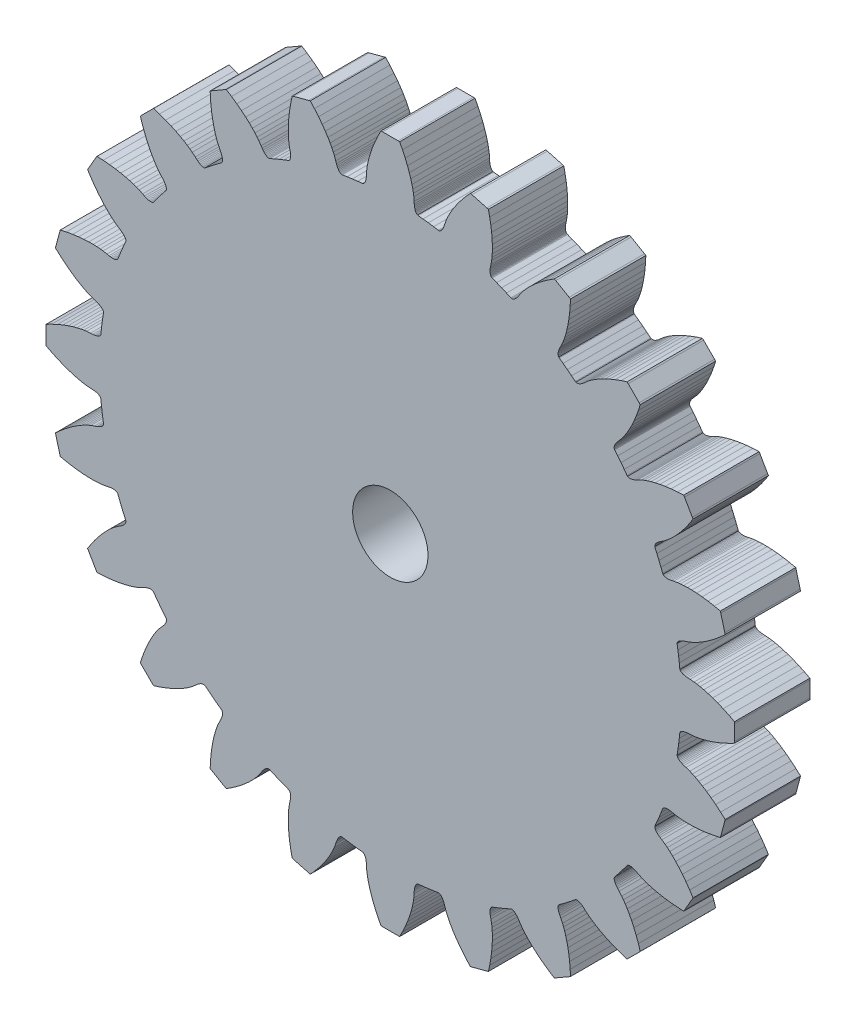
from build123d import *

# Parameters (mm, degrees)
SKETCH2_R           = 1.905
BOSS_EXTRUDE1_DEPTH = 3.81


with BuildPart() as part:
    # Sketch2 → Boss-Extrude1 (new body)
    with BuildSketch(Plane.XY):
        Polygon((3.289576242, 23.003571315), (3.038944057, 22.794199304), (2.802065264, 22.611666434), (2.578939862, 22.45437037), (2.372505468, 22.321776998), (2.181960915, 22.210281061), (2.010911459, 22.11908139), (1.861760607, 22.048044458), (1.731437212, 21.992229725), (1.541560299, 21.924130411), (1.439277799, 21.892217202), (1.369843203, 21.866179229), (1.308286764, 21.838672447), (1.25460848, 21.809696856), (1.20827424, 21.779920097), (1.169818157, 21.749475697), (1.138706117, 21.718363657), (1.115472233, 21.687919258), (1.100383561, 21.657474858), (1.092371877, 21.627030458), (1.093039517, 21.59164552), (1.130694433, 21.352630278), (1.168349348, 21.085173557), (1.201063725, 20.817983892), (1.226434058, 20.577366313), (1.235113382, 20.541981375), (1.250335582, 20.515142233), (1.273569466, 20.489638372), (1.304013865, 20.466538016), (1.341668781, 20.444772941), (1.386534212, 20.425277843), (1.439277799, 20.408586835), (1.498831317, 20.394165803), (1.565461823, 20.38401767), (1.638768733, 20.376673626), (1.745858244, 20.372400728), (1.947352099, 20.355843248), (2.087155986, 20.335413453), (2.249926702, 20.304969054), (2.439135974, 20.261572432), (2.651445603, 20.20295361), (2.885386779, 20.127510251), (3.14176067, 20.034040603), (3.417763187, 19.91880588), (3.713394331, 19.78127197), (3.991533297, 19.637862824), (3.993803274, 19.559615376), (3.993803274, 18.774203278), (3.991533297, 18.695421718), (3.713394331, 18.552546685), (3.417763187, 18.415012774), (3.14176067, 18.299778051), (2.885386779, 18.205640763), (2.651445603, 18.130998573), (2.439135974, 18.072246223), (2.249926702, 18.028849601), (2.087155986, 17.998405201), (1.947352099, 17.978108935), (1.745858244, 17.961551454), (1.638768733, 17.957145028), (1.565461823, 17.949800984), (1.498831317, 17.939118739), (1.439277799, 17.92523182), (1.386534212, 17.908540811), (1.341668781, 17.889045713), (1.304013865, 17.867280638), (1.273569466, 17.843379114), (1.250335582, 17.818008781), (1.235113382, 17.791303167), (1.226434058, 17.756452341), (1.201063725, 17.51596829), (1.168349348, 17.247843929), (1.130694433, 16.981321904), (1.093039517, 16.742306662), (1.092371877, 16.705987028), (1.100383561, 16.676343796), (1.115472233, 16.645899397), (1.138706117, 16.615454997), (1.169818157, 16.584342957), (1.20827424, 16.553898558), (1.25460848, 16.524255327), (1.308286764, 16.495279736), (1.369843203, 16.467639426), (1.439277799, 16.441601452), (1.541560299, 16.409688244), (1.731437212, 16.341588929), (1.861760607, 16.285907725), (2.010911459, 16.214203152), (2.181960915, 16.123537593), (2.372505468, 16.012041656), (2.578939862, 15.878780644), (2.802065264, 15.72148458), (3.038944057, 15.539619351), (3.289576242, 15.329579699), (3.520713328, 15.119540048), (3.501752342, 15.043429049), (3.299056735, 14.284188452), (3.276624019, 14.208878621), (2.971512383, 14.142915756), (2.649976794, 14.086433383), (2.353678011, 14.046642018), (2.081147223, 14.021939326), (1.836390274, 14.010455912), (1.615534849, 14.008987103), (1.422052678, 14.015529978), (1.256878457, 14.028482201), (1.116273401, 14.04517321), (0.917850692, 14.081359316), (0.812630574, 14.1045932), (0.740391889, 14.116877782), (0.673093742, 14.123420658), (0.612071415, 14.125557107), (0.557191379, 14.122619489), (0.508587162, 14.116210142), (0.466392293, 14.1045932), (0.431007355, 14.089371), (0.402031764, 14.071211183), (0.38013316, 14.048778467), (0.36290804, 14.017666428), (0.275981267, 13.791603408), (0.175301104, 13.541638864), (0.070348042, 13.293944297), (-0.028329201, 13.072287704), (-0.038343806, 13.038238046), (-0.038343806, 13.006992478), (-0.03113329, 12.973743989), (-0.016712259, 12.937557883), (0.005052816, 12.899902967), (0.033894879, 12.860779243), (0.070882154, 12.820186711), (0.115881113, 12.778125369), (0.168090588, 12.735396387), (0.228178219, 12.692654052), (0.318576721, 12.635423922), (0.48455211, 12.520242611), (0.595513935, 12.432568081), (0.721430903, 12.325358395), (0.863504768, 12.192791729), (1.018530855, 12.035589134), (1.183571548, 11.85375061), (1.358226261, 11.644391952), (1.54009149, 11.406778754), (1.727030786, 11.139468914), (1.896477905, 10.876485384), (1.858822989, 10.807665017), (1.466250468, 10.128140677), (1.425657936, 10.060775767), (1.112801671, 10.075263562), (0.788194937, 10.104239153), (0.491094985, 10.142641826), (0.222436512, 10.189723823), (-0.017379899, 10.241158834), (-0.231024808, 10.296946861), (-0.416495295, 10.354176992), (-0.572990191, 10.409230614), (-0.704114755, 10.461386678), (-0.886781152, 10.547605751), (-0.981586081, 10.597585307), (-1.049151283, 10.628016354), (-1.111909475, 10.651917878), (-1.170795353, 10.669303233), (-1.224340109, 10.680893469), (-1.272944326, 10.686688587), (-1.316340948, 10.686688587), (-1.354797032, 10.681614521), (-1.38737788, 10.671466388), (-1.414083494, 10.655536489), (-1.438786187, 10.629458457), (-1.580860051, 10.433866543), (-1.743096654, 10.218699413), (-1.908938515, 10.006443196), (-2.061828153, 9.818088503), (-2.079854443, 9.787657456), (-2.088533767, 9.757226409), (-2.090002576, 9.723190105), (-2.08559615, 9.684787432), (-2.074112736, 9.642779502), (-2.055952918, 9.597139608), (-2.030716114, 9.548588802), (-1.998802905, 9.496446092), (-1.959011541, 9.442100168), (-1.911876133, 9.384870038), (-1.839370392, 9.305914891), (-1.708913469, 9.151609855), (-1.624256673, 9.038591698), (-1.530787026, 8.90168537), (-1.427970413, 8.737218848), (-1.318610925, 8.545979948), (-1.206180291, 8.327194208), (-1.091746737, 8.07944623), (-0.977313182, 7.80343036), (-0.865683717, 7.496983443), (-0.770878789, 7.198534858), (-0.825224713, 7.142025779), (-1.380167365, 6.587109833), (-1.436516209, 6.532763909), (-1.73508497, 6.627662307), (-2.041531887, 6.739238361), (-2.317400876, 6.853698621), (-2.565228971, 6.968158882), (-2.784081475, 7.080455987), (-2.975293669, 7.189828828), (-3.139800249, 7.292712204), (-3.276666519, 7.386155147), (-3.389764793, 7.470905412), (-3.543989712, 7.601308923), (-3.623038329, 7.673761253), (-3.680188342, 7.720856603), (-3.734534266, 7.760688026), (-3.786610212, 7.792561176), (-3.835214429, 7.817918156), (-3.880881029, 7.836037915), (-3.92294237, 7.847628151), (-3.961264926, 7.851967813), (-3.995314583, 7.85052571), (-4.025625455, 7.84181968), (-4.056069854, 7.823726627), (-4.244477959, 7.670850341), (-4.456921115, 7.504955069), (-4.672034834, 7.34269176), (-4.867386398, 7.200698013), (-4.893557899, 7.176075437), (-4.909581267, 7.149263001), (-4.9197294, 7.116668799), (-4.924803467, 7.078266127), (-4.924803467, 7.034816093), (-4.91906176, 6.986265288), (-4.90731129, 6.932667121), (-4.890086169, 6.873981535), (-4.866184645, 6.810942934), (-4.835740245, 6.743578023), (-4.78566722, 6.648679625), (-4.699408088, 6.466133403), (-4.647332141, 6.334995487), (-4.592185049, 6.178527297), (-4.534901507, 5.993070162), (-4.479353831, 5.779345136), (-4.427678468, 5.539582137), (-4.380676588, 5.270790135), (-4.342220505, 4.973783653), (-4.313378442, 4.649243683), (-4.298823883, 4.336280596), (-4.366122029, 4.295701416), (-5.045646369, 3.903062131), (-5.114413324, 3.865393863), (-5.377463619, 4.034921099), (-5.64492034, 4.221820336), (-5.882466773, 4.403658859), (-6.091838784, 4.578246809), (-6.273570485, 4.743421029), (-6.43086655, 4.898433764), (-6.563459922, 5.040440864), (-6.670682961, 5.166478008), (-6.758410901, 5.277319658), (-6.873512096, 5.44321493), (-6.93066211, 5.533773666), (-6.97352462, 5.593901355), (-7.016120073, 5.646070771), (-7.058181415, 5.690976261), (-7.098907476, 5.727923477), (-7.1380312, 5.756899068), (-7.175686115, 5.778624085), (-7.211738694, 5.79311188), (-7.245120711, 5.800362454), (-7.276366279, 5.800362454), (-7.310282408, 5.790214321), (-7.532072529, 5.691710665), (-7.779900624, 5.586664134), (-8.029598112, 5.485957264), (-8.255661132, 5.399017139), (-8.2869067, 5.381645137), (-8.309339415, 5.359906768), (-8.327499233, 5.33094453), (-8.342721432, 5.295439417), (-8.354204846, 5.253418133), (-8.360747722, 5.204880681), (-8.363685339, 5.149827058), (-8.361415362, 5.088978317), (-8.355006015, 5.021600054), (-8.342721432, 4.949161077), (-8.319487549, 4.844114546), (-8.283167914, 4.645611719), (-8.266610433, 4.505073427), (-8.253524683, 4.339899207), (-8.246981807, 4.146470447), (-8.248450616, 3.925521552), (-8.25993403, 3.68065778), (-8.284636723, 3.408287227), (-8.324561615, 3.11197509), (-8.381043988, 2.790319326), (-8.446873326, 2.485341218), (-8.522183156, 2.462881797), (-9.281423753, 2.260052661), (-9.357534752, 2.241211851), (-9.567574403, 2.472308879), (-9.777747583, 2.722967769), (-9.959479284, 2.959846562), (-10.116775348, 3.182971964), (-10.250169889, 3.389446416), (-10.361532298, 3.579977617), (-10.452331384, 3.750933603), (-10.523902429, 3.900164572), (-10.579717161, 4.030554731), (-10.647682948, 4.220378233), (-10.679596157, 4.322527205), (-10.705767658, 4.392068623), (-10.73327444, 4.453638415), (-10.762383559, 4.507249935), (-10.79202679, 4.553624233), (-10.82247119, 4.592013552), (-10.85358323, 4.623165651), (-10.884027629, 4.646346123), (-10.914472029, 4.66155497), (-10.94411526, 4.669526596), (-10.980301367, 4.668792192), (-11.219316609, 4.631123924), (-11.485972161, 4.593455656), (-11.753962995, 4.560848101), (-11.994580574, 4.535504474), (-12.0294314, 4.526798444), (-12.056137013, 4.511589597), (-12.081507346, 4.488409124), (-12.10540887, 4.457978077), (-12.127173946, 4.420309809), (-12.146535515, 4.375390967), (-12.163226524, 4.322527205), (-12.177246971, 4.263107215), (-12.187929217, 4.196463356), (-12.195139732, 4.123289974), (-12.199679687, 4.016080288), (-12.216103639, 3.814693255), (-12.236533434, 3.674876015), (-12.266977833, 3.511878302), (-12.310374455, 3.322789204), (-12.369126805, 3.110532987), (-12.443635468, 2.8765384), (-12.537906284, 2.620097745), (-12.653007479, 2.344081875), (-12.790674917, 2.048504143), (-12.933416422, 1.770325118), (-13.012331511, 1.76814861), (-13.797743609, 1.76814861), (-13.875991057, 1.770325118), (-14.019266674, 2.048504143), (-14.156934113, 2.344081875), (-14.272035307, 2.620097745), (-14.365504955, 2.8765384), (-14.441081842, 3.110532987), (-14.499700664, 3.322789204), (-14.543097286, 3.511878302), (-14.573541686, 3.674876015), (-14.593837952, 3.814693255), (-14.610528961, 4.016080288), (-14.614801859, 4.123289974), (-14.622012375, 4.196463356), (-14.632160508, 4.263107215), (-14.646715067, 4.322527205), (-14.663406076, 4.375390967), (-14.682901174, 4.420309809), (-14.704666249, 4.457978077), (-14.727766605, 4.488409124), (-14.753270466, 4.511589597), (-14.779976079, 4.526798444), (-14.815494546, 4.535504474), (-15.055978597, 4.560848101), (-15.32330179, 4.593455656), (-15.590624982, 4.631123924), (-15.829640225, 4.668792192), (-15.865158691, 4.669526596), (-15.89560309, 4.66155497), (-15.92604749, 4.646346123), (-15.95649189, 4.623165651), (-15.98760393, 4.592013552), (-16.018048329, 4.553624233), (-16.047825088, 4.507249935), (-16.076800679, 4.453638415), (-16.104307461, 4.392068623), (-16.130345435, 4.322527205), (-16.162258643, 4.220378233), (-16.230357958, 4.030554731), (-16.286039162, 3.900164572), (-16.357076095, 3.750933603), (-16.448409293, 3.579977617), (-16.55990523, 3.389446416), (-16.692498602, 3.182971964), (-16.849661139, 2.959846562), (-17.032327536, 2.722967769), (-17.241566019, 2.472308879), (-17.452406839, 2.241211851), (-17.529185479, 2.260052661), (-18.287758435, 2.462881797), (-18.362400625, 2.485341218), (-18.429031131, 2.790319326), (-18.485513504, 3.11197509), (-18.524637228, 3.408287227), (-18.549206393, 3.68065778), (-18.561490975, 3.925521552), (-18.562959784, 4.146470447), (-18.555749268, 4.339899207), (-18.543464686, 4.505073427), (-18.526106037, 4.645611719), (-18.490587571, 4.844114546), (-18.466686047, 4.949161077), (-18.455069105, 5.021600054), (-18.447858589, 5.088978317), (-18.44638978, 5.149827058), (-18.448526229, 5.204880681), (-18.455736745, 5.253418133), (-18.467353687, 5.295439417), (-18.481908246, 5.33094453), (-18.500735704, 5.359906768), (-18.522500779, 5.381645137), (-18.554280459, 5.399017139), (-18.780343479, 5.485957264), (-19.030308023, 5.586664134), (-19.27800259, 5.691710665), (-19.498991543, 5.790214321), (-19.533708841, 5.800362454), (-19.564954409, 5.800362454), (-19.598202898, 5.79311188), (-19.633721364, 5.778624085), (-19.671376279, 5.756899068), (-19.711167644, 5.727923477), (-19.751813588, 5.690976261), (-19.793808165, 5.646070771), (-19.835842801, 5.593901355), (-19.879306187, 5.533773666), (-19.936536317, 5.44321493), (-20.051730982, 5.277319658), (-20.138644402, 5.166478008), (-20.246588492, 5.040440864), (-20.379168511, 4.898433764), (-20.535636702, 4.743421029), (-20.717475225, 4.578246809), (-20.927554935, 4.403658859), (-21.164460434, 4.221820336), (-21.431783627, 4.034921099), (-21.695461503, 3.865393863), (-21.765002921, 3.903062131), (-22.444527261, 4.295701416), (-22.511184473, 4.336280596), (-22.495975626, 4.649243683), (-22.467707734, 4.973783653), (-22.428597362, 5.270790135), (-22.382236417, 5.539582137), (-22.330067001, 5.779345136), (-22.274278974, 5.993070162), (-22.217796601, 6.178527297), (-22.162729626, 6.334995487), (-22.110560209, 6.466133403), (-22.024367841, 6.648679625), (-21.974388285, 6.743578023), (-21.943943886, 6.810942934), (-21.920042361, 6.873981535), (-21.901922602, 6.932667121), (-21.890332366, 6.986265288), (-21.884550601, 7.034816093), (-21.884550601, 7.078266127), (-21.890332366, 7.116668799), (-21.900480499, 7.149263001), (-21.916423751, 7.176075437), (-21.941780731, 7.200698013), (-22.13810705, 7.34269176), (-22.353247473, 7.504955069), (-22.565517044, 7.670850341), (-22.753871737, 7.823726627), (-22.784289431, 7.84181968), (-22.813999426, 7.85052571), (-22.848770135, 7.851967813), (-22.886438403, 7.847628151), (-22.928459686, 7.836037915), (-22.97409958, 7.817918156), (-23.023358084, 7.792561176), (-23.075527501, 7.760688026), (-23.129846719, 7.720856603), (-23.187076849, 7.673761253), (-23.266045349, 7.601308923), (-23.41961598, 7.470905412), (-23.533355189, 7.386155147), (-23.669553818, 7.292712204), (-23.834006987, 7.189828828), (-24.025980291, 7.080455987), (-24.244031627, 6.968158882), (-24.491792958, 6.853698621), (-24.768529879, 6.739238361), (-25.074963443, 6.627662307), (-25.37270433, 6.532763909), (-25.42993446, 6.587109833), (-25.985584811, 7.142025779), (-26.039182978, 7.198534858), (-25.94428458, 7.496983443), (-25.831987474, 7.80343036), (-25.718274971, 8.07944623), (-25.603080307, 8.327194208), (-25.490783201, 8.545979948), (-25.382131412, 8.737218848), (-25.279261388, 8.90168537), (-25.185805093, 9.038591698), (-25.101041475, 9.151609855), (-24.970637964, 9.305914891), (-24.897477935, 9.384870038), (-24.85111699, 9.442100168), (-24.811258861, 9.496446092), (-24.779399064, 9.548588802), (-24.754028731, 9.597139608), (-24.735922325, 9.642779502), (-24.724332089, 9.684787432), (-24.719979074, 9.723190105), (-24.721447882, 9.757226409), (-24.729406155, 9.787657456), (-24.748246966, 9.818088503), (-24.900375494, 10.006443196), (-25.066257413, 10.218699413), (-25.228534075, 10.433866543), (-25.371262227, 10.629458457), (-25.395898156, 10.655536489), (-25.422683886, 10.671466388), (-25.455291441, 10.681614521), (-25.492959709, 10.686688587), (-25.537157499, 10.686688587), (-25.585681599, 10.680893469), (-25.639306471, 10.669303233), (-25.697978705, 10.651917878), (-25.761003953, 10.628016354), (-25.828368863, 10.597585307), (-25.923267262, 10.547605751), (-26.105840189, 10.461386678), (-26.2369514, 10.409230614), (-26.393432943, 10.354176992), (-26.578890077, 10.296946861), (-26.791867346, 10.241158834), (-27.032391456, 10.189723823), (-27.301156752, 10.142641826), (-27.597455535, 10.104239153), (-27.92272991, 10.075263562), (-28.234958592, 10.060775767), (-28.276245471, 10.128140677), (-28.669605807, 10.807665017), (-28.706553024, 10.876485384), (-28.537052494, 11.139468914), (-28.350139904, 11.406778754), (-28.16830138, 11.644391952), (-27.992992379, 11.85375061), (-27.827831512, 12.035589134), (-27.673513123, 12.192791729), (-27.531519375, 12.325358395), (-27.405468879, 12.432568081), (-27.294640582, 12.520242611), (-27.128731957, 12.635423922), (-27.038173221, 12.692654052), (-26.978045532, 12.735396387), (-26.925902821, 12.778125369), (-26.880983979, 12.820186711), (-26.844036763, 12.860779243), (-26.814326767, 12.899902967), (-26.792588398, 12.937557883), (-26.778113955, 12.973743989), (-26.770863381, 13.006992478), (-26.771584433, 13.038238046), (-26.780998161, 13.072287704), (-26.880262927, 13.293944297), (-26.985296106, 13.541638864), (-27.086002975, 13.791603408), (-27.172929748, 14.017666428), (-27.190328455, 14.048778467), (-27.212040119, 14.071211183), (-27.240308011, 14.089371), (-27.275799772, 14.1045932), (-27.318542106, 14.116210142), (-27.367079559, 14.122619489), (-27.422146534, 14.125557107), (-27.482995275, 14.123420658), (-27.549639134, 14.116877782), (-27.622812516, 14.1045932), (-27.727124643, 14.081359316), (-27.926335168, 14.04517321), (-28.066152408, 14.028482201), (-28.23204768, 14.015529978), (-28.42547644, 14.008987103), (-28.645704283, 14.010455912), (-28.891289106, 14.021939326), (-29.162965314, 14.046642018), (-29.459971797, 14.086433383), (-29.780893156, 14.142915756), (-30.086605669, 14.208878621), (-30.10906509, 14.284188452), (-30.312641983, 15.043429049), (-30.330735036, 15.119540048), (-30.098916957, 15.329579699), (-29.848992471, 15.539619351), (-29.612100325, 15.72148458), (-29.388974923, 15.878780644), (-29.182500471, 16.012041656), (-28.991982623, 16.123537593), (-28.821013284, 16.214203152), (-28.671061263, 16.285907725), (-28.541392156, 16.341588929), (-28.35159536, 16.409688244), (-28.248725336, 16.441601452), (-28.179891617, 16.467639426), (-28.118321824, 16.495279736), (-28.064710305, 16.524255327), (-28.01834936, 16.553898558), (-27.97996004, 16.584342957), (-27.948794589, 16.615454997), (-27.925614116, 16.645899397), (-27.909684218, 16.676343796), (-27.902433644, 16.705987028), (-27.903154695, 16.742306662), (-27.940822963, 16.981321904), (-27.978504584, 17.247843929), (-28.011098786, 17.51596829), (-28.036469119, 17.756452341), (-28.045148443, 17.791303167), (-28.060370643, 17.818008781), (-28.083551115, 17.843379114), (-28.113968809, 17.867280638), (-28.151637077, 17.889045713), (-28.19655592, 17.908540811), (-28.248725336, 17.92523182), (-28.308118621, 17.939118739), (-28.374775832, 17.949800984), (-28.448656913, 17.957145028), (-28.555866599, 17.961551454), (-28.756545933, 17.978108935), (-28.897084225, 17.998405201), (-29.059360886, 18.028849601), (-29.248436631, 18.072246223), (-29.4614139, 18.130998573), (-29.69542184, 18.205640763), (-29.951141443, 18.299778051), (-30.227878365, 18.415012774), (-30.523442744, 18.552546685), (-30.801621769, 18.695421718), (-30.803798277, 18.774203278), (-30.803798277, 19.559615376), (-30.801621769, 19.637862824), (-30.523442744, 19.78127197), (-30.227878365, 19.91880588), (-29.951141443, 20.034040603), (-29.69542184, 20.127510251), (-29.4614139, 20.20295361), (-29.248436631, 20.261572432), (-29.059360886, 20.304969054), (-28.897084225, 20.335413453), (-28.756545933, 20.355843248), (-28.555866599, 20.372400728), (-28.448656913, 20.376673626), (-28.374775832, 20.38401767), (-28.308118621, 20.394165803), (-28.248725336, 20.408586835), (-28.19655592, 20.425277843), (-28.151637077, 20.444772941), (-28.113968809, 20.466538016), (-28.083551115, 20.489638372), (-28.060370643, 20.515142233), (-28.045148443, 20.541981375), (-28.036469119, 20.577366313), (-28.011098786, 20.817983892), (-27.978504584, 21.085173557), (-27.940822963, 21.352630278), (-27.903154695, 21.59164552), (-27.902433644, 21.627030458), (-27.909684218, 21.657474858), (-27.925614116, 21.687919258), (-27.948794589, 21.718363657), (-27.97996004, 21.749475697), (-28.01834936, 21.779920097), (-28.064710305, 21.809696856), (-28.118321824, 21.838672447), (-28.179891617, 21.866179229), (-28.248725336, 21.892217202), (-28.35159536, 21.924130411), (-28.541392156, 21.992229725), (-28.671061263, 22.048044458), (-28.821013284, 22.11908139), (-28.991982623, 22.210281061), (-29.182500471, 22.321776998), (-29.388974923, 22.45437037), (-29.612100325, 22.611666434), (-29.848992471, 22.794199304), (-30.098916957, 23.003571315), (-30.330735036, 23.214412135), (-30.312641983, 23.291190774), (-30.10906509, 24.049630202), (-30.086605669, 24.124272393), (-29.780893156, 24.190769371), (-29.459971797, 24.247385272), (-29.162965314, 24.286508996), (-28.891289106, 24.311211688), (-28.645704283, 24.323362743), (-28.42547644, 24.324965079), (-28.23204768, 24.317621036), (-28.066152408, 24.305469981), (-27.926335168, 24.287977805), (-27.727124643, 24.252592866), (-27.622812516, 24.228691342), (-27.549639134, 24.216940872), (-27.482995275, 24.209730356), (-27.422146534, 24.208261548), (-27.367079559, 24.210531525), (-27.318542106, 24.217742041), (-27.275799772, 24.229358982), (-27.240308011, 24.243913542), (-27.212040119, 24.262607472), (-27.190328455, 24.284239019), (-27.172929748, 24.316152227), (-27.086002975, 24.542215247), (-26.985296106, 24.792313319), (-26.880262927, 25.040007885), (-26.780998161, 25.26086331), (-26.771584433, 25.295714136), (-26.770863381, 25.326692648), (-26.778113955, 25.360074665), (-26.792588398, 25.39572666), (-26.814326767, 25.433381575), (-26.844036763, 25.473306467), (-26.880983979, 25.513631944), (-26.925902821, 25.555826813), (-26.978045532, 25.597621099), (-27.038173221, 25.641284777), (-27.128731957, 25.69843479), (-27.294640582, 25.813535985), (-27.405468879, 25.900596286), (-27.531519375, 26.008486965), (-27.673513123, 26.141080337), (-27.827831512, 26.297575233), (-27.992992379, 26.479306934), (-28.16830138, 26.689480114), (-28.350139904, 26.926225379), (-28.537052494, 27.1936821), (-28.706553024, 27.457400035), (-28.669605807, 27.526968158), (-28.276245471, 28.206492498), (-28.234958592, 28.273123004), (-27.92272991, 28.257900805), (-27.597455535, 28.229726382), (-27.301156752, 28.19046913), (-27.032391456, 28.14413489), (-26.791867346, 28.092058944), (-26.578890077, 28.036244211), (-26.393432943, 27.97962831), (-26.2369514, 27.924614746), (-26.105840189, 27.872538799), (-25.923267262, 27.786279667), (-25.828368863, 27.73634017), (-25.761003953, 27.70589577), (-25.697978705, 27.681994246), (-25.639306471, 27.663834428), (-25.585681599, 27.652351015), (-25.537157499, 27.64647578), (-25.492959709, 27.64647578), (-25.455291441, 27.652351015), (-25.422683886, 27.66236562), (-25.395898156, 27.67825546), (-25.371262227, 27.703759321), (-25.228534075, 27.899912053), (-25.066257413, 28.115292828), (-24.900375494, 28.327468928), (-24.748246966, 28.515877033), (-24.729406155, 28.546187904), (-24.721447882, 28.575964663), (-24.719979074, 28.610815489), (-24.724332089, 28.648470404), (-24.735922325, 28.690398218), (-24.754028731, 28.735931289), (-24.779399064, 28.785336675), (-24.811258861, 28.837412621), (-24.85111699, 28.891758545), (-24.897477935, 28.949042086), (-24.970637964, 29.028090703), (-25.101041475, 29.181647981), (-25.185805093, 29.295280368), (-25.279261388, 29.431478997), (-25.382131412, 29.595985577), (-25.490783201, 29.787865412), (-25.603080307, 30.005916747), (-25.718274971, 30.253744842), (-25.831987474, 30.530415), (-25.94428458, 30.836861917), (-26.039182978, 31.134629509), (-25.985584811, 31.191779522), (-25.42993446, 31.747523343), (-25.37270433, 31.801201626), (-25.074963443, 31.70626317), (-24.768529879, 31.593832536), (-24.491792958, 31.48020015), (-24.244031627, 31.364965427), (-24.025980291, 31.25280185), (-23.834006987, 31.144110002), (-23.669553818, 31.041159861), (-23.533355189, 30.947690213), (-23.41961598, 30.86289989), (-23.266045349, 30.732576495), (-23.187076849, 30.659269586), (-23.129846719, 30.612935346), (-23.075527501, 30.57327751), (-23.023358084, 30.541364301), (-22.97409958, 30.515993968), (-22.928459686, 30.497834151), (-22.886438403, 30.486350737), (-22.848770135, 30.481810783), (-22.813999426, 30.483279592), (-22.784289431, 30.491291276), (-22.753871737, 30.510252261), (-22.565517044, 30.662340731), (-22.353247473, 30.82831612), (-22.13810705, 30.990552723), (-21.941780731, 31.1331607), (-21.916423751, 31.157863393), (-21.900480499, 31.184569007), (-21.890332366, 31.217149855), (-21.884550601, 31.254804771), (-21.884550601, 31.299136089), (-21.890332366, 31.347606778), (-21.901922602, 31.401151533), (-21.920042361, 31.459903884), (-21.943943886, 31.522929132), (-21.974388285, 31.590360806), (-22.024367841, 31.685299263), (-22.110560209, 31.867698604), (-22.162729626, 31.998823167), (-22.217796601, 32.155451592), (-22.274278974, 32.34078855), (-22.330067001, 32.553765819), (-22.382236417, 32.794249871), (-22.428597362, 33.063041872), (-22.467707734, 33.359340656), (-22.495975626, 33.68461503), (-22.511184473, 33.996803654), (-22.444527261, 34.038197355), (-21.765002921, 34.431437517), (-21.695461503, 34.468424791), (-21.431783627, 34.298844145), (-21.164460434, 34.112171905), (-20.927554935, 33.930173148), (-20.717475225, 33.754984322), (-20.535636702, 33.589676574), (-20.379168511, 33.435451655), (-20.246588492, 33.293511318), (-20.138644402, 33.167460822), (-20.051730982, 33.056498997), (-19.936536317, 32.890790664), (-19.879306187, 32.799991577), (-19.835842801, 32.739903947), (-19.793808165, 32.687828), (-19.751813588, 32.642962569), (-19.711167644, 32.605841766), (-19.671376279, 32.576198535), (-19.633721364, 32.55443346), (-19.598202898, 32.540012428), (-19.564954409, 32.532801913), (-19.533708841, 32.533469553), (-19.498991543, 32.542950046), (-19.27800259, 32.642161401), (-19.030308023, 32.74724799), (-18.780343479, 32.847928154), (-18.554280459, 32.934854927), (-18.522500779, 32.952347103), (-18.500735704, 32.973978651), (-18.481908246, 33.002153073), (-18.467353687, 33.037805067), (-18.455736745, 33.080400521), (-18.448526229, 33.129004738), (-18.44638978, 33.18415183), (-18.447858589, 33.244907101), (-18.455069105, 33.311537607), (-18.466686047, 33.384710989), (-18.490587571, 33.48899641), (-18.526106037, 33.688220288), (-18.543464686, 33.828024176), (-18.555749268, 33.993999565), (-18.562959784, 34.187481736), (-18.561490975, 34.407535992), (-18.549206393, 34.653361166), (-18.524637228, 34.924823729), (-18.485513504, 35.221923681), (-18.429031131, 35.542791629), (-18.362400625, 35.848570906), (-18.287758435, 35.871003621), (-17.529185479, 36.074633926), (-17.452406839, 36.092660215), (-17.241566019, 35.860855488), (-17.032327536, 35.611024472), (-16.849661139, 35.374012151), (-16.692498602, 35.150886749), (-16.55990523, 34.944452355), (-16.448409293, 34.75404133), (-16.357076095, 34.582991874), (-16.286039162, 34.433039853), (-16.230357958, 34.303384099), (-16.162258643, 34.113373658), (-16.130345435, 34.010690573), (-16.104307461, 33.941923618), (-16.076800679, 33.880367178), (-16.047825088, 33.826688895), (-16.018048329, 33.780354655), (-15.98760393, 33.741765044), (-15.95649189, 33.710786532), (-15.92604749, 33.687686176), (-15.89560309, 33.671662808), (-15.865158691, 33.664452292), (-15.829640225, 33.664986404), (-15.590624982, 33.702774848), (-15.32330179, 33.740429763), (-15.055978597, 33.772877083), (-14.815494546, 33.798380945), (-14.779976079, 33.807060269), (-14.753270466, 33.822282469), (-14.727766605, 33.845516353), (-14.704666249, 33.875827224), (-14.682901174, 33.913482139), (-14.663406076, 33.95834757), (-14.646715067, 34.010690573), (-14.632160508, 34.069977036), (-14.622012375, 34.136607542), (-14.614801859, 34.210582092), (-14.610528961, 34.31780513), (-14.593837952, 34.518497817), (-14.573541686, 34.659102873), (-14.543097286, 34.821339476), (-14.499700664, 35.010281693), (-14.441081842, 35.22339249), (-14.365504955, 35.457200138), (-14.272035307, 35.713039917), (-14.156934113, 35.989843602), (-14.019266674, 36.285341217), (-13.875991057, 36.563480184), (-13.797743609, 36.565750161), (-13.012331511, 36.565750161), (-12.933416422, 36.563480184), (-12.790674917, 36.285341217), (-12.653007479, 35.989843602), (-12.537906284, 35.713039917), (-12.443635468, 35.457200138), (-12.369126805, 35.22339249), (-12.310374455, 35.010281693), (-12.266977833, 34.821339476), (-12.236533434, 34.659102873), (-12.216103639, 34.518497817), (-12.199679687, 34.31780513), (-12.195139732, 34.210582092), (-12.187929217, 34.136607542), (-12.177246971, 34.069977036), (-12.163226524, 34.010690573), (-12.146535515, 33.95834757), (-12.127173946, 33.913482139), (-12.10540887, 33.875827224), (-12.081507346, 33.845516353), (-12.056137013, 33.822282469), (-12.0294314, 33.807060269), (-11.994580574, 33.798380945), (-11.753962995, 33.772877083), (-11.485972161, 33.740429763), (-11.219316609, 33.702774848), (-10.980301367, 33.664986404), (-10.94411526, 33.664452292), (-10.914472029, 33.671662808), (-10.884027629, 33.687686176), (-10.85358323, 33.710786532), (-10.82247119, 33.741765044), (-10.79202679, 33.780354655), (-10.762383559, 33.826688895), (-10.73327444, 33.880367178), (-10.705767658, 33.941923618), (-10.679596157, 34.010690573), (-10.647682948, 34.113373658), (-10.579717161, 34.303384099), (-10.523902429, 34.433039853), (-10.452331384, 34.582991874), (-10.361532298, 34.75404133), (-10.250169889, 34.944452355), (-10.116775348, 35.150886749), (-9.959479284, 35.374012151), (-9.777747583, 35.611024472), (-9.567574403, 35.860855488), (-9.357534752, 36.092660215), (-9.281423753, 36.074633926), (-8.522183156, 35.871003621), (-8.446873326, 35.848570906), (-8.381043988, 35.542791629), (-8.324561615, 35.221923681), (-8.284636723, 34.924823729), (-8.25993403, 34.653361166), (-8.248450616, 34.407535992), (-8.246981807, 34.187481736), (-8.253524683, 33.993999565), (-8.266610433, 33.828024176), (-8.283167914, 33.688220288), (-8.319487549, 33.48899641), (-8.342721432, 33.384710989), (-8.355006015, 33.311537607), (-8.361415362, 33.244907101), (-8.363685339, 33.18415183), (-8.360747722, 33.129004738), (-8.354204846, 33.080400521), (-8.342721432, 33.037805067), (-8.327499233, 33.002153073), (-8.309339415, 32.973978651), (-8.2869067, 32.952347103), (-8.255661132, 32.934854927), (-8.029598112, 32.847928154), (-7.779900624, 32.74724799), (-7.532072529, 32.642161401), (-7.310282408, 32.542950046), (-7.276366279, 32.533469553), (-7.245120711, 32.532801913), (-7.211738694, 32.540012428), (-7.175686115, 32.55443346), (-7.1380312, 32.576198535), (-7.098907476, 32.605841766), (-7.058181415, 32.642962569), (-7.016120073, 32.687828), (-6.97352462, 32.739903947), (-6.93066211, 32.799991577), (-6.873512096, 32.890790664), (-6.758410901, 33.056498997), (-6.670682961, 33.167460822), (-6.563459922, 33.293511318), (-6.43086655, 33.435451655), (-6.273570485, 33.589676574), (-6.091838784, 33.754984322), (-5.882466773, 33.930173148), (-5.64492034, 34.112171905), (-5.377463619, 34.298844145), (-5.114413324, 34.468424791), (-5.045646369, 34.431437517), (-4.366122029, 34.038197355), (-4.298823883, 33.996803654), (-4.313378442, 33.68461503), (-4.342220505, 33.359340656), (-4.380676588, 33.063041872), (-4.427678468, 32.794249871), (-4.479353831, 32.553765819), (-4.534901507, 32.34078855), (-4.592185049, 32.155451592), (-4.647332141, 31.998823167), (-4.699408088, 31.867698604), (-4.78566722, 31.685299263), (-4.835740245, 31.590360806), (-4.866184645, 31.522929132), (-4.890086169, 31.459903884), (-4.90731129, 31.401151533), (-4.91906176, 31.347606778), (-4.924803467, 31.299136089), (-4.924803467, 31.254804771), (-4.9197294, 31.217149855), (-4.909581267, 31.184569007), (-4.893557899, 31.157863393), (-4.867386398, 31.1331607), (-4.672034834, 30.990552723), (-4.456921115, 30.82831612), (-4.244477959, 30.662340731), (-4.056069854, 30.510252261), (-4.025625455, 30.491291276), (-3.995314583, 30.483279592), (-3.961264926, 30.481810783), (-3.92294237, 30.486350737), (-3.880881029, 30.497834151), (-3.835214429, 30.515993968), (-3.786610212, 30.541364301), (-3.734534266, 30.57327751), (-3.680188342, 30.612935346), (-3.623038329, 30.659269586), (-3.543989712, 30.732576495), (-3.389764793, 30.86289989), (-3.276666519, 30.947690213), (-3.139800249, 31.041159861), (-2.975293669, 31.144110002), (-2.784081475, 31.25280185), (-2.565228971, 31.364965427), (-2.317400876, 31.48020015), (-2.041531887, 31.593832536), (-1.73508497, 31.70626317), (-1.436516209, 31.801201626), (-1.380167365, 31.747523343), (-0.825224713, 31.191779522), (-0.770878789, 31.134629509), (-0.865683717, 30.836861917), (-0.977313182, 30.530415), (-1.091746737, 30.253744842), (-1.206180291, 30.005916747), (-1.318610925, 29.787865412), (-1.427970413, 29.595985577), (-1.530787026, 29.431478997), (-1.624256673, 29.295280368), (-1.708913469, 29.181647981), (-1.839370392, 29.028090703), (-1.911876133, 28.949042086), (-1.959011541, 28.891758545), (-1.998802905, 28.837412621), (-2.030716114, 28.785336675), (-2.055952918, 28.735931289), (-2.074112736, 28.690398218), (-2.08559615, 28.648470404), (-2.090002576, 28.610815489), (-2.088533767, 28.575964663), (-2.079854443, 28.546187904), (-2.061828153, 28.515877033), (-1.908938515, 28.327468928), (-1.743096654, 28.115292828), (-1.580860051, 27.899912053), (-1.438786187, 27.703759321), (-1.414083494, 27.67825546), (-1.38737788, 27.66236562), (-1.354797032, 27.652351015), (-1.316340948, 27.64647578), (-1.272944326, 27.64647578), (-1.224340109, 27.652351015), (-1.170795353, 27.663834428), (-1.111909475, 27.681994246), (-1.049151283, 27.70589577), (-0.981586081, 27.73634017), (-0.886781152, 27.786279667), (-0.704114755, 27.872538799), (-0.572990191, 27.924614746), (-0.416495295, 27.97962831), (-0.231024808, 28.036244211), (-0.017379899, 28.092058944), (0.222436512, 28.14413489), (0.491094985, 28.19046913), (0.788194937, 28.229726382), (1.112801671, 28.257900805), (1.425657936, 28.273123004), (1.466250468, 28.206492498), (1.858822989, 27.526968158), (1.896477905, 27.457400035), (1.727030786, 27.1936821), (1.54009149, 26.926225379), (1.358226261, 26.689480114), (1.183571548, 26.479306934), (1.018530855, 26.297575233), (0.863504768, 26.141080337), (0.721430903, 26.008486965), (0.595513935, 25.900596286), (0.48455211, 25.813535985), (0.318576721, 25.69843479), (0.228178219, 25.641284777), (0.168090588, 25.597621099), (0.115881113, 25.555826813), (0.070882154, 25.513631944), (0.033894879, 25.473306467), (0.005052816, 25.433381575), (-0.016712259, 25.39572666), (-0.03113329, 25.360074665), (-0.038343806, 25.326692648), (-0.038343806, 25.295714136), (-0.028329201, 25.26086331), (0.070348042, 25.040007885), (0.175301104, 24.792313319), (0.275981267, 24.542215247), (0.36290804, 24.316152227), (0.38013316, 24.284239019), (0.402031764, 24.262607472), (0.431007355, 24.243913542), (0.466392293, 24.229358982), (0.508587162, 24.217742041), (0.557191379, 24.210531525), (0.612071415, 24.208261548), (0.673093742, 24.209730356), (0.740391889, 24.216940872), (0.812630574, 24.228691342), (0.917850692, 24.252592866), (1.116273401, 24.287977805), (1.256878457, 24.305469981), (1.422052678, 24.317621036), (1.615534849, 24.324965079), (1.836390274, 24.323362743), (2.081147223, 24.311211688), (2.353678011, 24.286508996), (2.649976794, 24.247385272), (2.971512383, 24.190769371), (3.276624019, 24.124272393), (3.299056735, 24.049630202), (3.501752342, 23.291190774), (3.520713328, 23.214412135), align=None)
        with Locations((-13.40503756, 19.167042855)):
            Circle(SKETCH2_R, mode=Mode.SUBTRACT)
    extrude(amount=BOSS_EXTRUDE1_DEPTH)


solid = part.part
